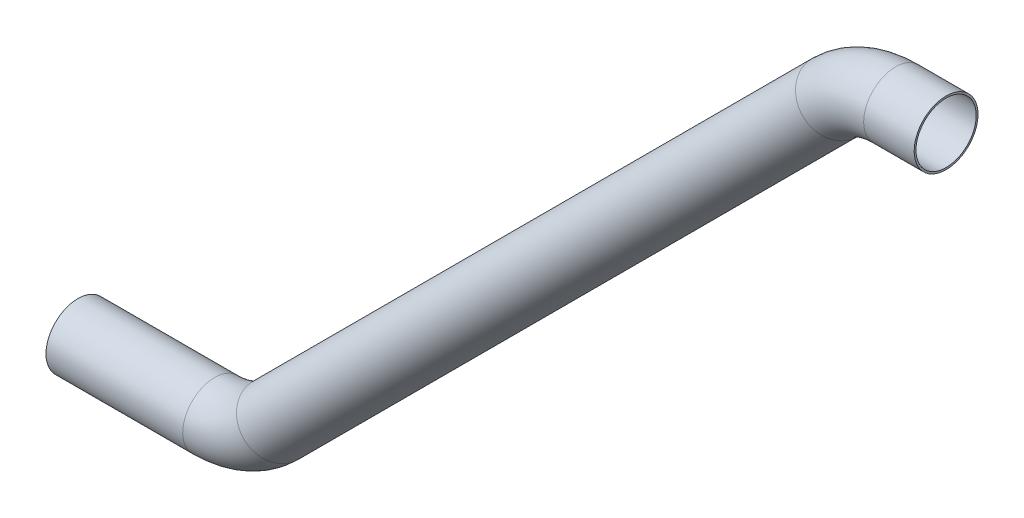
from build123d import *

# Parameters (mm, degrees)
BARRER2_PROFILE_R = 55.5625
VACIADO1_T        = -3.175


with BuildPart() as part:
    # Barrer2: sweep along a path in Croquis1
    with BuildLine(Plane.XY) as barrer2_path:
        Line((0, 0), (237.867965644, 0))
        ThreePointArc((237.867965644, 0), (295.270480499, 11.418070123), (343.933982822, 43.933982822))
        Line((343.933982822, 43.933982822), (1316.726188958, 1016.726188958))
        ThreePointArc((1316.726188958, 1016.726188958), (1365.389691281, 1049.242101657), (1422.792206136, 1060.66017178))
        Line((1422.792206136, 1060.66017178), (1510.66017178, 1060.66017178))
    # Barrer2 profile (on start of the path) → Barrer2 (sweep)
    with BuildSketch(Plane.YZ):
        Circle(BARRER2_PROFILE_R)
    sweep(path=barrer2_path.line)

    # Vaciado1
    vaciado1_openings = [part.faces().sort_by_distance(p)[0] for p in [
        (1510.66017178, 1060.66017178, 0),
    ]]
    offset(amount=VACIADO1_T, openings=vaciado1_openings, kind=Kind.INTERSECTION)


solid = part.part
